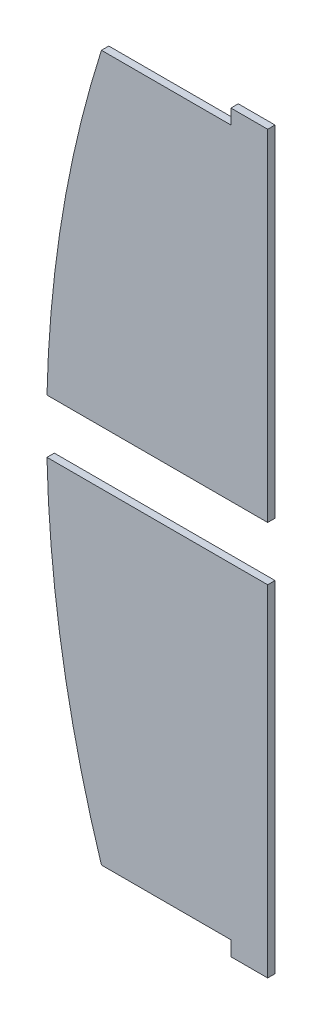
from build123d import *

# Parameters (mm, degrees)
SKETCH1_R           = 950
SKETCH1_R_2         = 840
BASE_FLANGE1_DEPTH  = 6
SKETCH6_W           = 3903.37574265
SKETCH6_H           = 2501.66331226
SKETCH6_W_2         = 2732.981099596
SKETCH6_H_2         = 600
CUT_EXTRUDE1_DEPTH  = 10
BOSS_EXTRUDE1_DEPTH = 6
SKETCH8_W           = 418.285884571
SKETCH8_H           = 44
CUT_EXTRUDE2_DEPTH  = 10
SKETCH13_W          = 115.405661545
SKETCH13_H          = 12
CUT_EXTRUDE3_DEPTH  = 10
SKETCH14_W          = 124.238303048
SKETCH14_H          = 12
CUT_EXTRUDE4_DEPTH  = 10


# Sheet-metal steps are written as plain solids
with BuildPart() as part:
    # Sketch1 → Base-Flange1 (new body)
    with BuildSketch(Plane.XY):
        Circle(SKETCH1_R)
        Circle(SKETCH1_R_2, mode=Mode.SUBTRACT)
    extrude(amount=-BASE_FLANGE1_DEPTH)

    # Sketch6 → Cut-Extrude1 (cut)
    with BuildSketch(Plane.XY):
        Rectangle(SKETCH6_W, SKETCH6_H)
        with Locations((-160.657409421, 0)):
            Rectangle(SKETCH6_W_2, SKETCH6_H_2, mode=Mode.SUBTRACT)
    extrude(amount=-CUT_EXTRUDE1_DEPTH, mode=Mode.SUBTRACT)


with BuildPart() as cut_extrude1_kept_piece:
    # of the separate pieces the step leaves, the one the design keeps (cut_extrude1_pieces_kept)
    add(part.part.solids().sort_by_distance((-901.387818866, 300, 0))[0])

    # Sketch7 → Boss-Extrude1 (add)
    with BuildSketch(Plane.XY):
        with BuildLine():
            Line((-784.601809837, 300), (-769.601809837, 300))
            Line((-769.601809837, 300), (-769.601809837, -300))
            Line((-769.601809837, -300), (-784.601809837, -300))
            ThreePointArc((-784.601809837, -300), (-840, 0), (-784.601809837, 300))
        make_face()
    extrude(amount=-BOSS_EXTRUDE1_DEPTH)

    # Sketch8 → Cut-Extrude2 (cut)
    with BuildSketch(Plane.XY):
        with Locations((-769.601809838, 0)):
            Rectangle(SKETCH8_W, SKETCH8_H)
    extrude(amount=-CUT_EXTRUDE2_DEPTH, mode=Mode.SUBTRACT)


with BuildPart() as cut_extrude2_piece_1:
    # of the separate pieces the step leaves, piece 1, a body of its own (cut_extrude2_pieces)
    add(cut_extrude1_kept_piece.part.solids().sort_by_distance((-949.745228996, -22, 0))[0])

    # Sketch14 → Cut-Extrude4 (cut)
    with BuildSketch(Plane.XY):
        with Locations((-861.720961361, -294)):
            Rectangle(SKETCH14_W, SKETCH14_H)
    extrude(amount=-CUT_EXTRUDE4_DEPTH, mode=Mode.SUBTRACT)


with BuildPart() as cut_extrude2_piece_2:
    # of the separate pieces the step leaves, piece 2, a body of its own (cut_extrude2_pieces)
    add(cut_extrude1_kept_piece.part.solids().sort_by_distance((-901.387818866, 300, 0))[0])

    # Sketch13 → Cut-Extrude3 (cut)
    with BuildSketch(Plane.XY):
        with Locations((-857.304640609, 294)):
            Rectangle(SKETCH13_W, SKETCH13_H)
    extrude(amount=-CUT_EXTRUDE3_DEPTH, mode=Mode.SUBTRACT)


solid = Compound([cut_extrude2_piece_1.part, cut_extrude2_piece_2.part])
